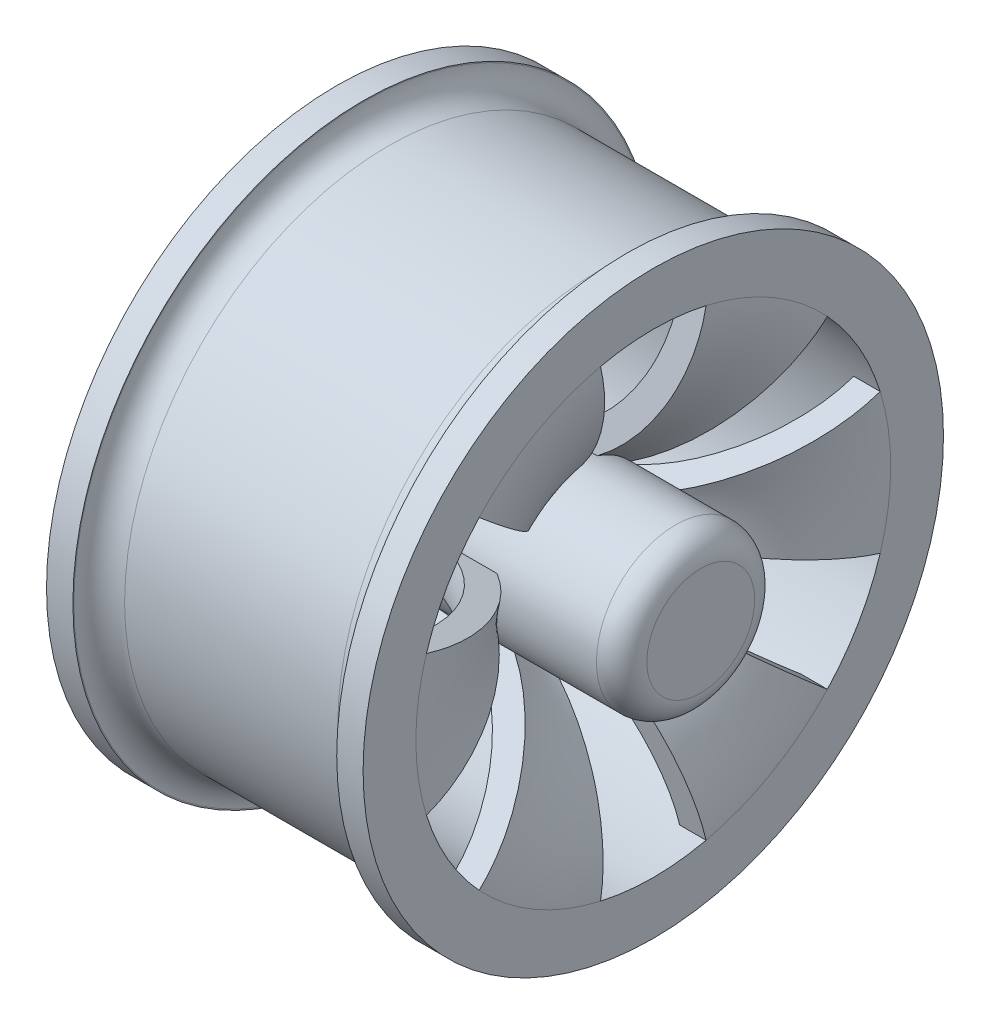
from build123d import *
from build123d.topology import SkipClean

# Parameters (mm, degrees)
SKETCH2_R           = 19.050218964
SKETCH2_R_2         = 12.7
BOSS_EXTRUDE1_DEPTH = 82.55
CUT_EXTRUDE1_DEPTH  = 125.757705234
CIRPATTERN1_COUNT   = 6
SKETCH7_R           = 19.050218964
BOSS_EXTRUDE2_DEPTH = 5.08
FILLET2_R           = 6.0706


with BuildPart() as part:
    # Sketch1 → Revolve1 (revolve)
    with BuildSketch(Plane.XY):
        with BuildLine():
            Line((-38.1, 57.15), (31.75, 57.15))
            add(Edge.make_bspline(
                [(31.75, 57.15), (31.75, 56.632440738), (31.72466741, 55.607252315), (31.572103804, 53.481168953), (31.190075356, 50.755546379), (30.429316936, 47.411807097), (29.023497801, 42.933120679), (26.560861839, 37.423765079), (22.604883458, 31.351809227), (17.811789162, 26.18183978), (13.277223168, 22.883629655), (9.404272062, 20.96113192), (6.385825481, 19.895795432), (3.770224253, 19.337360029), (1.632230172, 19.10176351), (0.536721469, 19.055228469), (0, 19.050218072)],
                knots=[0, 0, 0, 0, 0.03125, 0.0625, 0.125, 0.1875, 0.25, 0.375, 0.5, 0.625, 0.75, 0.8125, 0.875, 0.9375, 0.96875, 0.99911509, 0.99911509, 0.99911509, 0.99911509], degree=3))
            Line((0, 19.050218072), (0, 12.7))
            add(Edge.make_bspline(
                [(38.1, 57.15), (38.1, 37.456588081), (22.471125344, 12.866027587), (0, 12.7)],
                knots=[0, 0, 0, 0, 1, 1, 1, 1], degree=3))
            Line((38.1, 57.15), (38.1, 69.85))
            Line((38.1, 69.85), (31.75, 69.85))
            Line((31.75, 69.85), (31.75, 69.596))
            ThreePointArc((31.75, 69.596), (29.964522938, 65.285477062), (25.654, 63.5))
            Line((25.654, 63.5), (-25.654, 63.5))
            ThreePointArc((-25.654, 63.5), (-29.964522938, 65.285477062), (-31.75, 69.596))
            Line((-31.75, 69.596), (-31.75, 69.85))
            Line((-31.75, 69.85), (-38.1, 69.85))
            Line((-38.1, 69.85), (-38.1, 57.15))
        make_face()
    revolve(axis=Axis((0, 0, 0), (1, 0, 0)))

    # Sketch2 → Boss-Extrude1 (add)
    with BuildSketch(Plane.ZY.offset(38.1)):
        Circle(SKETCH2_R)
        Circle(SKETCH2_R_2, mode=Mode.SUBTRACT)
    extrude(amount=-BOSS_EXTRUDE1_DEPTH)

    # Sketch5 → Cut-Extrude1 (cut, through all)
    with BuildSketch(Plane(origin=(38.1, 0, 0), x_dir=(0, 0, -1), z_dir=(1, 0, 0))):
        with BuildLine():
            Line((-12.7, 55.72102386), (-4.233381992, 18.573888109))
            ThreePointArc((-4.233381992, 18.573888109), (0.872097867, 19.030246658), (5.91443918, 18.108844572))
            Line((5.91443918, 18.108844572), (12.7, 55.72102386))
            ThreePointArc((12.7, 55.72102386), (0, 57.15), (-12.7, 55.72102386))
        make_face()
    cut_extrude1 = extrude(amount=-CUT_EXTRUDE1_DEPTH, mode=Mode.SUBTRACT)

    # CirPattern1: Cut-Extrude1 ×6 about axis
    cirpattern1_axis = Axis((44.45, 0, 0), (-1, 0, 0))
    for i in range(1, CIRPATTERN1_COUNT):
        add(cut_extrude1.rotate(cirpattern1_axis, i * 360 / CIRPATTERN1_COUNT), mode=Mode.SUBTRACT)

    # Sketch7 → Boss-Extrude2 (add)
    with SkipClean():  # the faces are left unmerged after this step: merging them gives an invalid solid
        with BuildSketch(Plane(origin=(44.45, 0, 0), x_dir=(0, 0, -1), z_dir=(1, 0, 0))):
            Circle(SKETCH7_R)
        extrude(amount=BOSS_EXTRUDE2_DEPTH)

    # Fillet2
    fillet2_edges = [part.edges().sort_by_distance(p)[0] for p in [
        (49.53, 0, 19.050218964),
    ]]
    fillet(fillet2_edges, radius=FILLET2_R)


solid = part.part
